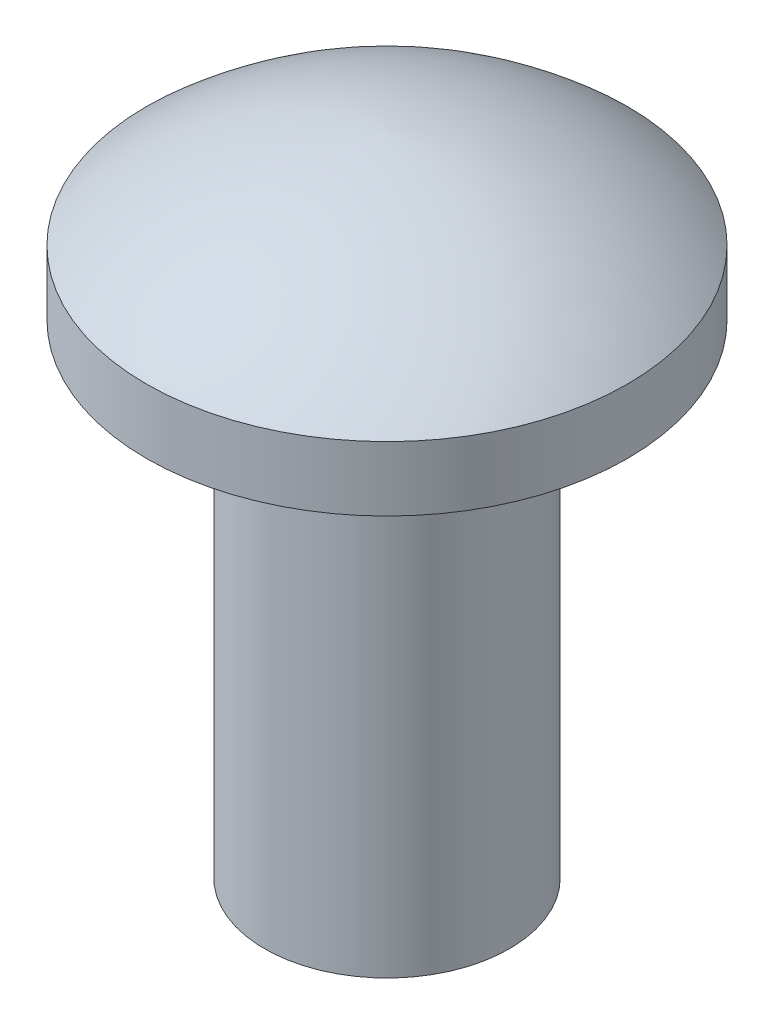
from build123d import *


with BuildPart() as part:
    # Sketch1 → Revolve1 (revolve)
    with BuildSketch(Plane.XY):
        with BuildLine():
            Line((0, 0), (0, 12.7))
            ThreePointArc((0, 12.7), (2.53056206, 12.15036999), (4.7371, 10.795))
            Line((4.7371, 10.795), (4.7371, 9.525))
            Line((4.7371, 9.525), (2.413, 9.525))
            Line((2.413, 9.525), (2.413, 0))
            Line((2.413, 0), (0, 0))
        make_face()
    revolve(axis=Axis((0, 0, 0), (0, 1, 0)))


solid = part.part
